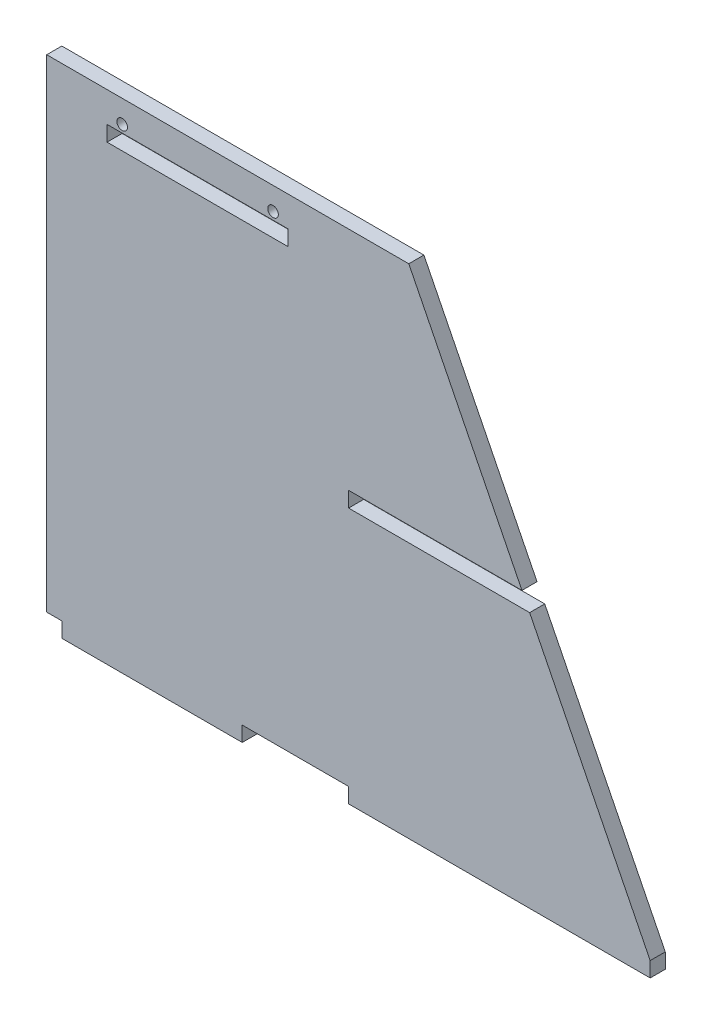
from build123d import *

# Parameters (mm, degrees)
BOSS_EXTRUDE1_DEPTH = 5
SKETCH2_W           = 60
SKETCH2_H           = 5.1
CUT_EXTRUDE1_DEPTH  = 5
SKETCH3_R           = 1.75
CUT_EXTRUDE2_DEPTH  = 5
SKETCH4_W           = 60
SKETCH4_H           = 5.1
CUT_EXTRUDE3_DEPTH  = 5


with BuildPart() as part:
    # Sketch1 → Boss-Extrude1 (new body)
    with BuildSketch(Plane.XY):
        Polygon((0, 160), (0, 0), (5, 0), (5, -5), (64.8, -5), (64.8, 0), (100, 0), (100, -5), (200, -5), (200, 0), (120, 160), align=None)
    extrude(amount=BOSS_EXTRUDE1_DEPTH)

    # Sketch2 → Cut-Extrude1 (cut)
    with BuildSketch(Plane.XY.offset(5)):
        with Locations((50, 147.45)):
            Rectangle(SKETCH2_W, SKETCH2_H)
    extrude(amount=-CUT_EXTRUDE1_DEPTH, mode=Mode.SUBTRACT)

    # Sketch3 → Cut-Extrude2 (cut)
    with BuildSketch(Plane.XY.offset(5)):
        with Locations((25, 152.5)):
            Circle(SKETCH3_R)
        with Locations((75, 152.5)):
            Circle(SKETCH3_R)
    extrude(amount=-CUT_EXTRUDE2_DEPTH, mode=Mode.SUBTRACT)

    # Sketch4 → Cut-Extrude3 (cut)
    with BuildSketch(Plane.XY.offset(5)):
        with Locations((130.05, 82.45)):
            Rectangle(SKETCH4_W, SKETCH4_H)
    extrude(amount=-CUT_EXTRUDE3_DEPTH, mode=Mode.SUBTRACT)


solid = part.part
